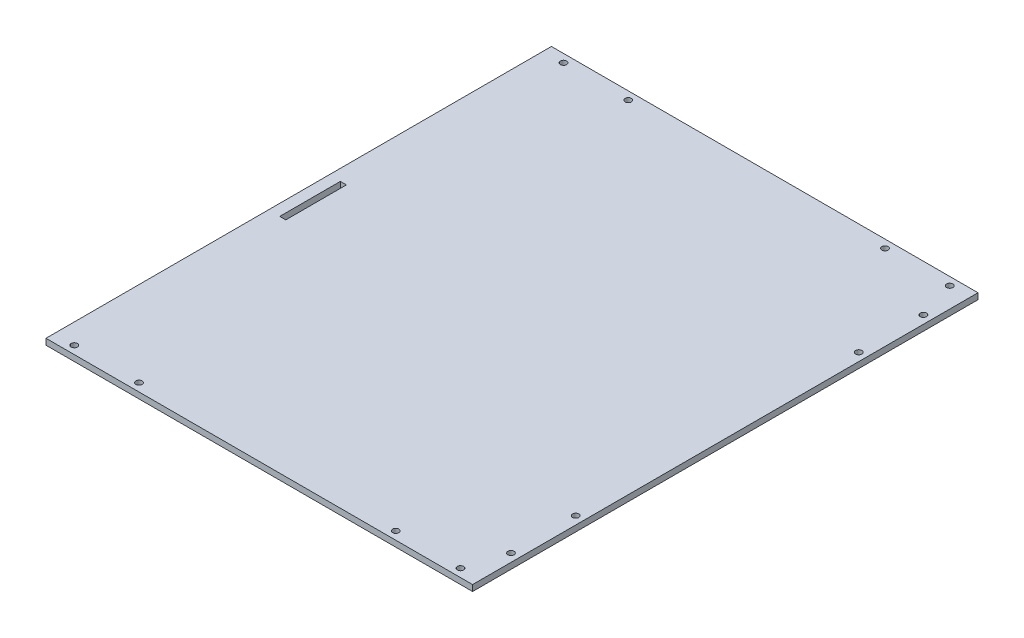
from build123d import *

# Parameters (mm, degrees)
SKETCH1_W           = 211
SKETCH1_H           = 250
SKETCH1_R           = 1.55
SKETCH1_W_2         = 3
SKETCH1_H_2         = 30
BOSS_EXTRUDE1_DEPTH = 3


with BuildPart() as part:
    # Sketch1 → Boss-Extrude1 (new body)
    with BuildSketch(Plane(origin=(0, 0, 0), x_dir=(1, 0, 0), z_dir=(0, 1, 0))):
        with Locations((105.5, 125)):
            Rectangle(SKETCH1_W, SKETCH1_H)
        with Locations((10, 4)):
            Circle(SKETCH1_R, mode=Mode.SUBTRACT)
        with Locations((42, 4)):
            Circle(SKETCH1_R, mode=Mode.SUBTRACT)
        with Locations((42, 246)):
            Circle(SKETCH1_R, mode=Mode.SUBTRACT)
        with Locations((10, 246)):
            Circle(SKETCH1_R, mode=Mode.SUBTRACT)
        with Locations((169, 4)):
            Circle(SKETCH1_R, mode=Mode.SUBTRACT)
        with Locations((201, 4)):
            Circle(SKETCH1_R, mode=Mode.SUBTRACT)
        with Locations((169, 246)):
            Circle(SKETCH1_R, mode=Mode.SUBTRACT)
        with Locations((201, 246)):
            Circle(SKETCH1_R, mode=Mode.SUBTRACT)
        with Locations((207, 23)):
            Circle(SKETCH1_R, mode=Mode.SUBTRACT)
        with Locations((207, 55)):
            Circle(SKETCH1_R, mode=Mode.SUBTRACT)
        with Locations((207, 227)):
            Circle(SKETCH1_R, mode=Mode.SUBTRACT)
        with Locations((207, 195)):
            Circle(SKETCH1_R, mode=Mode.SUBTRACT)
        with Locations((7.1, 125)):
            Rectangle(SKETCH1_W_2, SKETCH1_H_2, mode=Mode.SUBTRACT)
    extrude(amount=BOSS_EXTRUDE1_DEPTH)


solid = part.part
